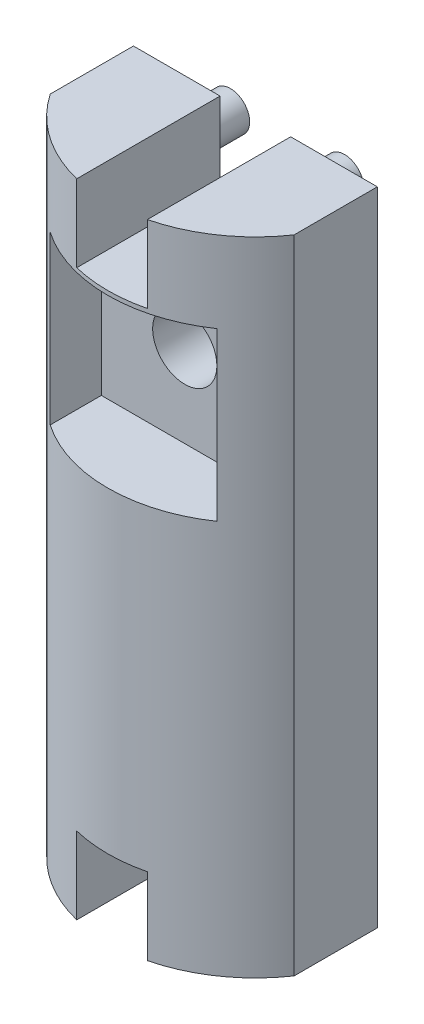
from build123d import *

# Parameters (mm, degrees)
EXTRUDE_1_DEPTH     = 100
SKETCH_2_R          = 3
SKETCH_2_R_2        = 0.9
EXTRUDE_2_DEPTH     = 5
SKETCH_4_W          = 66.593168222
SKETCH_4_H          = 122.189299492
SKETCH_4_W_2        = 38
SKETCH_4_H_2        = 100
CUT_EXTRUDE_1_DEPTH = 106.157025443
CUT_EXTRUDE_START   = -23
SKETCH_5_W          = 26
SKETCH_5_H          = 26
CUT_EXTRUDE_2_DEPTH = 12
SKETCH_6_R          = 5
CUT_EXTRUDE_3_DEPTH = 32
SKETCH_7_W          = 11
SKETCH_7_H          = 12
CUT_EXTRUDE_4_DEPTH = 105.355162786
SKETCH_8_W          = 20
SKETCH_8_H          = 50
CUT_EXTRUDE_5_DEPTH = 3


with BuildPart() as part:
    # Эскиз1 → Бобышка-Вытянуть1 (new body)
    with BuildSketch(Plane(origin=(0, 0, 0), x_dir=(1, 0, 0), z_dir=(0, 1, 0))):
        with BuildLine():
            Line((-23, 0), (23, 0))
            ThreePointArc((23, 0), (0, -23), (-23, 0))
        make_face()
    extrude(amount=EXTRUDE_1_DEPTH)

    # Эскиз2 → Бобышка-Вытянуть2 (add)
    # profile 1 of 4: a face of its own
    with BuildSketch(Plane(origin=(0, 0, 0), x_dir=(-1, 0, 0), z_dir=(0, 0, -1))):
        with Locations((-8.89, 93.815)):
            Circle(SKETCH_2_R)
        with Locations((-8.89, 93.815)):
            Circle(SKETCH_2_R_2, mode=Mode.SUBTRACT)
    # profile 2 of 4: a face of its own
    with BuildSketch(Plane(origin=(0, 0, 0), x_dir=(-1, 0, 0), z_dir=(0, 0, -1))):
        with Locations((8.89, 93.815)):
            Circle(SKETCH_2_R)
        with Locations((8.89, 93.815)):
            Circle(SKETCH_2_R_2, mode=Mode.SUBTRACT)
    # profile 3 of 4: a face of its own
    with BuildSketch(Plane(origin=(0, 0, 0), x_dir=(-1, 0, 0), z_dir=(0, 0, -1))):
        with Locations((-8.89, 6.185)):
            Circle(SKETCH_2_R)
        with Locations((-8.89, 6.185)):
            Circle(SKETCH_2_R_2, mode=Mode.SUBTRACT)
    # profile 4 of 4: a face of its own
    with BuildSketch(Plane(origin=(0, 0, 0), x_dir=(-1, 0, 0), z_dir=(0, 0, -1))):
        with Locations((8.89, 6.185)):
            Circle(SKETCH_2_R)
        with Locations((8.89, 6.185)):
            Circle(SKETCH_2_R_2, mode=Mode.SUBTRACT)
    extrude(amount=EXTRUDE_2_DEPTH)

    # Эскиз4 → Вырез-Вытянуть1 (cut, through all)
    with BuildSketch(Plane(origin=(0, 0, 0), x_dir=(-1, 0, 0), z_dir=(0, 0, -1))):
        with Locations((0, 49.541790127)):
            Rectangle(SKETCH_4_W, SKETCH_4_H)
        with Locations((0, 50)):
            Rectangle(SKETCH_4_W_2, SKETCH_4_H_2, mode=Mode.SUBTRACT)
    extrude(amount=-CUT_EXTRUDE_1_DEPTH, mode=Mode.SUBTRACT)

    # Эскиз5 → Вырез-Вытянуть2 (cut)
    with BuildSketch(Plane(origin=(0, 0, 0), x_dir=(-1, 0, 0), z_dir=(0, 0, -1)).offset(CUT_EXTRUDE_START)):
        with Locations((0, 74.350689365)):
            Rectangle(SKETCH_5_W, SKETCH_5_H)
    extrude(amount=CUT_EXTRUDE_2_DEPTH, mode=Mode.SUBTRACT)

    # Эскиз6 → Вырез-Вытянуть3 (cut)
    with BuildSketch(Plane.XY.offset(11)):
        with Locations((0, 74.350689365)):
            Circle(SKETCH_6_R)
    extrude(amount=-CUT_EXTRUDE_3_DEPTH, mode=Mode.SUBTRACT)

    # Эскиз7 → Вырез-Вытянуть4 (cut, through all)
    with BuildSketch(Plane(origin=(0, 0, 0), x_dir=(-1, 0, 0), z_dir=(0, 0, -1))):
        with Locations((0, 94)):
            Rectangle(SKETCH_7_W, SKETCH_7_H)
        with Locations((0, 6)):
            Rectangle(SKETCH_7_W, SKETCH_7_H)
    extrude(amount=-CUT_EXTRUDE_4_DEPTH, mode=Mode.SUBTRACT)

    # Эскиз8 → Вырез-Вытянуть5 (cut)
    with BuildSketch(Plane(origin=(0, 0, 0), x_dir=(-1, 0, 0), z_dir=(0, 0, -1))):
        with Locations((0, 63)):
            Rectangle(SKETCH_8_W, SKETCH_8_H)
    extrude(amount=-CUT_EXTRUDE_5_DEPTH, mode=Mode.SUBTRACT)


solid = part.part
